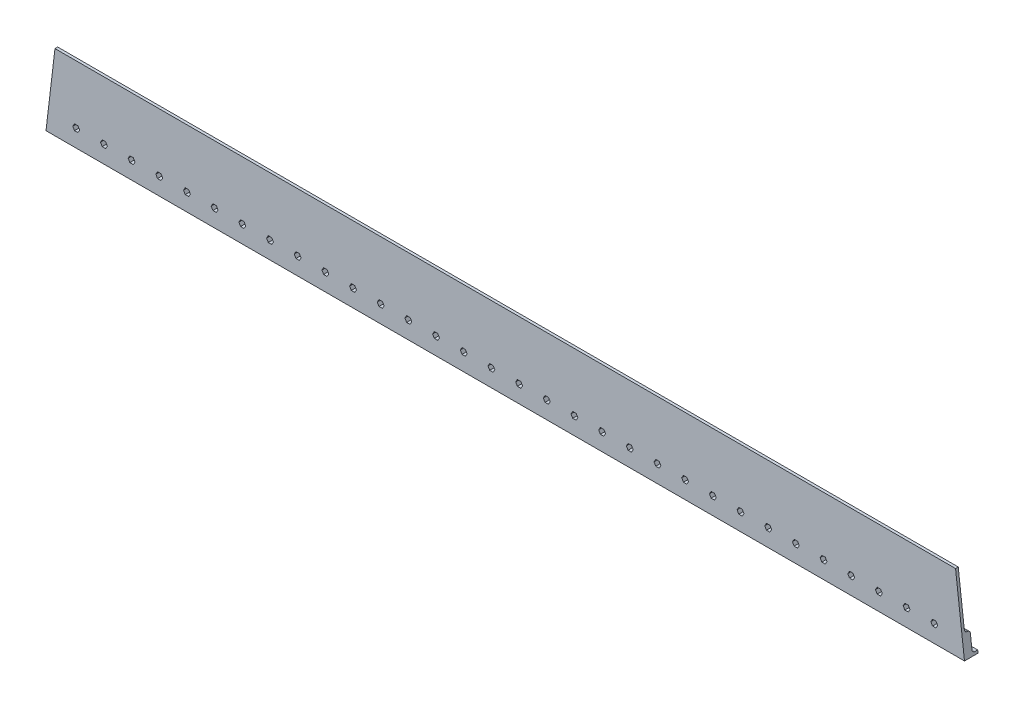
from build123d import *

# Parameters (mm, degrees)
GENERAL_EXTRUDE_DEPTH                             = 850.07
ROUNDING_R                                        = 5
SLANT_CUT_TO_FIT_WITH_HORIZONAL_SIDING_DEPTH      = 862.883985754
SLANT_CUT_TO_FIT_WITH_HORIZONAL_SIDING_DEPTH_BACK = 862.883985754
ROLLER_CUTS_DEPTH                                 = 862.883985754
ROLLER_CUTS_DEPTH_BACK                            = 862.883985754


with BuildPart() as part:
    # Sketch1 → General extrude (new, symmetric)
    with BuildSketch(Plane(origin=(0, 0, 0), x_dir=(0, 0, -1), z_dir=(1, 0, 0))):
        Polygon((0, 0), (0, 140), (5, 140), (5, 40), (15, 40), (15, 5), (25, 5), (25, 0), align=None)
    extrude(amount=GENERAL_EXTRUDE_DEPTH, both=True)

    # Rounding
    rounding_edges = [part.edges().sort_by_distance(p)[0] for p in [
        (0, 5, -15),
        (0, 40, -15),
        (0, 40, -5),
    ]]
    fillet(rounding_edges, radius=ROUNDING_R - 0.0001)  # a hair under: the kernel refuses the full size

    # Sketch2 → Slant cut (to fit with horizonal siding) (cut, two sides: drawn at the far end of the back side and taken through both)
    with BuildSketch(Plane.XY.offset(-SLANT_CUT_TO_FIT_WITH_HORIZONAL_SIDING_DEPTH_BACK)):
        Polygon((-850.07, 0), (-850.07, 140), (-833.490884705, 140), align=None)
        Polygon((833.490884705, 140), (850.07, 0), (850.07, 140), align=None)
    extrude(amount=SLANT_CUT_TO_FIT_WITH_HORIZONAL_SIDING_DEPTH + SLANT_CUT_TO_FIT_WITH_HORIZONAL_SIDING_DEPTH_BACK, mode=Mode.SUBTRACT)

    # Sketch3 → Roller cuts (cut, two sides: drawn at the far end of the back side and taken through both)
    with BuildSketch(Plane.XY.offset(-ROLLER_CUTS_DEPTH_BACK)):
        Polygon((-790.925259435, 26.5), (-787.749832955, 32), (-790.925259435, 37.5), (-797.276112396, 37.5), (-800.451538877, 32), (-797.276112396, 26.5), align=None)
        Polygon((-739.692957118, 26.5), (-736.517530637, 32), (-739.692957118, 37.5), (-746.043810079, 37.5), (-749.21923656, 32), (-746.043810079, 26.5), align=None)
        Polygon((-688.460654801, 26.5), (-685.28522832, 32), (-688.460654801, 37.5), (-694.811507762, 37.5), (-697.986934242, 32), (-694.811507762, 26.5), align=None)
        Polygon((-637.228352484, 26.5), (-634.052926003, 32), (-637.228352484, 37.5), (-643.579205445, 37.5), (-646.754631925, 32), (-643.579205445, 26.5), align=None)
        Polygon((-585.996050167, 26.5), (-582.820623686, 32), (-585.996050167, 37.5), (-592.346903128, 37.5), (-595.522329608, 32), (-592.346903128, 26.5), align=None)
        Polygon((-534.763747849, 26.5), (-531.588321369, 32), (-534.763747849, 37.5), (-541.114600811, 37.5), (-544.290027291, 32), (-541.114600811, 26.5), align=None)
        Polygon((-483.531445532, 26.5), (-480.356019052, 32), (-483.531445532, 37.5), (-489.882298493, 37.5), (-493.057724974, 32), (-489.882298493, 26.5), align=None)
        Polygon((-432.299143215, 26.5), (-429.123716735, 32), (-432.299143215, 37.5), (-438.649996176, 37.5), (-441.825422657, 32), (-438.649996176, 26.5), align=None)
        Polygon((-381.066840898, 26.5), (-377.891414417, 32), (-381.066840898, 37.5), (-387.417693859, 37.5), (-390.59312034, 32), (-387.417693859, 26.5), align=None)
        Polygon((-329.834538581, 26.5), (-326.6591121, 32), (-329.834538581, 37.5), (-336.185391542, 37.5), (-339.360818023, 32), (-336.185391542, 26.5), align=None)
        Polygon((-278.602236264, 26.5), (-275.426809783, 32), (-278.602236264, 37.5), (-284.953089225, 37.5), (-288.128515705, 32), (-284.953089225, 26.5), align=None)
        Polygon((-227.369933947, 26.5), (-224.194507466, 32), (-227.369933947, 37.5), (-233.720786908, 37.5), (-236.896213388, 32), (-233.720786908, 26.5), align=None)
        Polygon((-176.137631629, 26.5), (-172.962205149, 32), (-176.137631629, 37.5), (-182.488484591, 37.5), (-185.663911071, 32), (-182.488484591, 26.5), align=None)
        Polygon((-124.905329312, 26.5), (-121.729902832, 32), (-124.905329312, 37.5), (-131.256182273, 37.5), (-134.431608754, 32), (-131.256182273, 26.5), align=None)
        Polygon((-73.673026995, 26.5), (-70.497600515, 32), (-73.673026995, 37.5), (-80.023879956, 37.5), (-83.199306437, 32), (-80.023879956, 26.5), align=None)
        Polygon((-22.440724678, 26.5), (-19.265298197, 32), (-22.440724678, 37.5), (-28.791577639, 37.5), (-31.96700412, 32), (-28.791577639, 26.5), align=None)
        Polygon((28.791577639, 26.5), (31.96700412, 32), (28.791577639, 37.5), (22.440724678, 37.5), (19.265298197, 32), (22.440724678, 26.5), align=None)
        Polygon((80.023879956, 26.5), (83.199306437, 32), (80.023879956, 37.5), (73.673026995, 37.5), (70.497600515, 32), (73.673026995, 26.5), align=None)
        Polygon((131.256182273, 26.5), (134.431608754, 32), (131.256182273, 37.5), (124.905329312, 37.5), (121.729902832, 32), (124.905329312, 26.5), align=None)
        Polygon((182.488484591, 26.5), (185.663911071, 32), (182.488484591, 37.5), (176.137631629, 37.5), (172.962205149, 32), (176.137631629, 26.5), align=None)
        Polygon((233.720786908, 26.5), (236.896213388, 32), (233.720786908, 37.5), (227.369933947, 37.5), (224.194507466, 32), (227.369933947, 26.5), align=None)
        Polygon((284.953089225, 26.5), (288.128515705, 32), (284.953089225, 37.5), (278.602236264, 37.5), (275.426809783, 32), (278.602236264, 26.5), align=None)
        Polygon((336.185391542, 26.5), (339.360818023, 32), (336.185391542, 37.5), (329.834538581, 37.5), (326.6591121, 32), (329.834538581, 26.5), align=None)
        Polygon((387.417693859, 26.5), (390.59312034, 32), (387.417693859, 37.5), (381.066840898, 37.5), (377.891414417, 32), (381.066840898, 26.5), align=None)
        Polygon((438.649996176, 26.5), (441.825422657, 32), (438.649996176, 37.5), (432.299143215, 37.5), (429.123716735, 32), (432.299143215, 26.5), align=None)
        Polygon((489.882298493, 26.5), (493.057724974, 32), (489.882298493, 37.5), (483.531445532, 37.5), (480.356019052, 32), (483.531445532, 26.5), align=None)
        Polygon((541.114600811, 26.5), (544.290027291, 32), (541.114600811, 37.5), (534.763747849, 37.5), (531.588321369, 32), (534.763747849, 26.5), align=None)
        Polygon((592.346903128, 26.5), (595.522329608, 32), (592.346903128, 37.5), (585.996050167, 37.5), (582.820623686, 32), (585.996050167, 26.5), align=None)
        Polygon((643.579205445, 26.5), (646.754631925, 32), (643.579205445, 37.5), (637.228352484, 37.5), (634.052926003, 32), (637.228352484, 26.5), align=None)
        Polygon((694.811507762, 26.5), (697.986934242, 32), (694.811507762, 37.5), (688.460654801, 37.5), (685.28522832, 32), (688.460654801, 26.5), align=None)
        Polygon((746.043810079, 26.5), (749.21923656, 32), (746.043810079, 37.5), (739.692957118, 37.5), (736.517530637, 32), (739.692957118, 26.5), align=None)
        Polygon((797.276112396, 26.5), (800.451538877, 32), (797.276112396, 37.5), (790.925259435, 37.5), (787.749832955, 32), (790.925259435, 26.5), align=None)
    extrude(amount=ROLLER_CUTS_DEPTH + ROLLER_CUTS_DEPTH_BACK, mode=Mode.SUBTRACT)


solid = part.part
